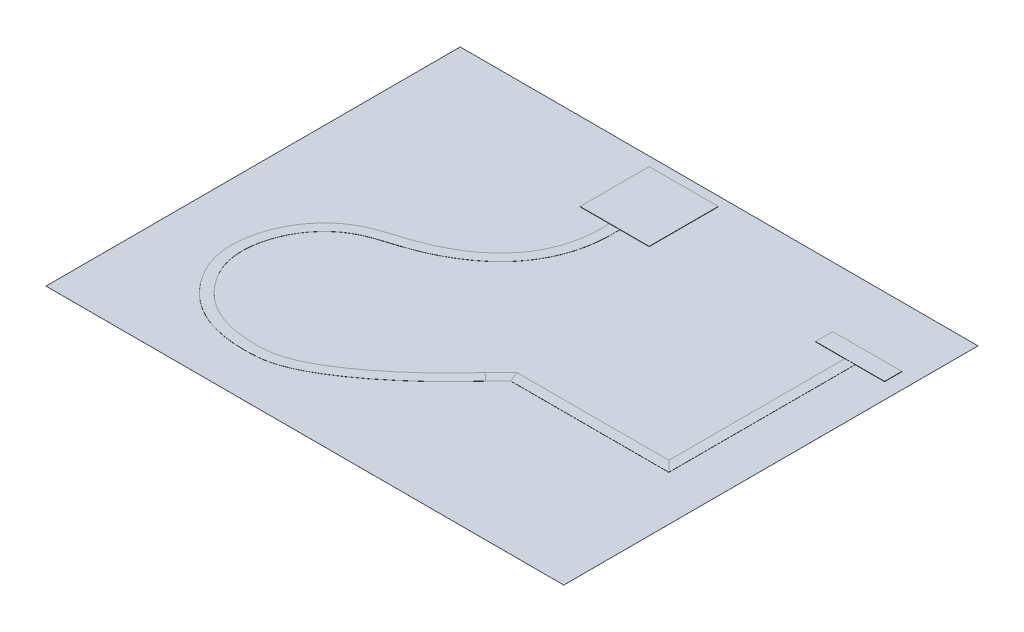
from build123d import *

# Parameters (mm, degrees)
SWEEP4_START             = -0.5
SWEEP4_DEPTH             = 1
BOSS_EXTRUDE3_DEPTH      = 1
BOSS_EXTRUDE3_DEPTH_BACK = 1
SKETCH13_W               = 200
SKETCH13_H               = 50
BOSS_EXTRUDE4_DEPTH      = 1
BOSS_EXTRUDE4_DEPTH_BACK = 1
SKETCH16_W               = 200
SKETCH16_H               = 200
SKETCH1_W                = 1500
SKETCH1_H                = 1200
BOSS_EXTRUDE6_DEPTH      = 0.05


# Read off the part's stored shape, not the designer's step: Sweep4
with BuildPart() as part:
    # Sweep4 outline → Sweep4 (new body)
    with BuildSketch(Plane(origin=(0, 0, 0), x_dir=(1, 0, 0), z_dir=(0, 1, 0)).offset(SWEEP4_START)):
        with BuildLine():
            add(Edge.make_bspline(
                [(103.505719826, -181.364046094), (103.414207185, -181.466182097), (103.322204924, -181.568864565), (101.691118748, -183.389296481), (100.158411854, -185.090003528), (97.050983778, -188.518394912), (95.485899265, -190.235324614), (90.757620947, -195.393015991), (87.561402627, -198.840678935), (77.849331178, -209.200915736), (71.210063445, -216.130726327), (50.86793851, -236.9067526), (36.740719705, -250.73948142), (-6.783621906, -291.529807765), (-37.326878896, -317.779689886), (-98.465326769, -364.920374117), (-129.070949841, -385.809866865), (-172.609372808, -410.526244062), (-186.724869551, -417.661513541), (-213.690796644, -429.313124446), (-226.542146561, -433.825702637), (-247.545765202, -439.164920147), (-256.185663263, -440.655396551), (-274.017116901, -442.591507677), (-283.217372406, -443.030595236), (-309.993475221, -443.44486218), (-328.36780961, -442.914218831), (-366.622997668, -438.136318085), (-386.492449198, -433.891740554), (-425.965147585, -419.62467904), (-445.568964912, -409.617407297), (-483.062343379, -381.585284748), (-500.975442865, -363.55489786), (-524.469479441, -329.8168627), (-531.234671318, -318.590235131), (-539.73656659, -300.420757864), (-542.297071011, -294.142513988), (-546.714261172, -281.132679535), (-548.56477247, -274.416950719), (-552.874769461, -253.433753177), (-554.135250856, -238.294079995), (-553.22480771, -206.868917306), (-551.056003291, -190.585562173), (-539.266410305, -141.746136524), (-524.359412718, -109.238143899), (-491.269439791, -66.966315646), (-478.455270713, -53.947722922), (-449.179171373, -31.013479434), (-432.71813341, -21.093925215), (-399.019942157, -6.624636989), (-381.799364398, -1.25136522), (-354.009683511, 7.304719653), (-344.423223242, 10.245336108), (-324.77160927, 16.742204503), (-314.722409469, 20.321758125), (-264.229433387, 40.021435969), (-222.612320366, 61.524314733), (-166.551476335, 105.442366663), (-148.930888002, 122.031207585), (-117.308840032, 159.590300645), (-103.311088676, 180.564246243), (-80.489992118, 227.233738595), (-71.673011905, 252.925040407), (-60.664159611, 309.198751903), (-58.470178144, 339.775960502), (-60.2136918, 372.901094516)],
                knots=[-0.000324793, -0.000324793, -0.000324793, -0.000324793, 0, 0, 0.005507124, 0.005507124, 0.011014249, 0.011014249, 0.022028497, 0.022028497, 0.044056995, 0.044056995, 0.088113989, 0.088113989, 0.176227978, 0.176227978, 0.264341967, 0.264341967, 0.308398962, 0.308398962, 0.352455956, 0.352455956, 0.385895355, 0.385895355, 0.419334753, 0.419334753, 0.4747688, 0.4747688, 0.530202848, 0.530202848, 0.585636895, 0.585636895, 0.641070943, 0.641070943, 0.665548814, 0.665548814, 0.67778775, 0.67778775, 0.690026686, 0.690026686, 0.714504557, 0.714504557, 0.738982428, 0.738982428, 0.787938171, 0.787938171, 0.812416042, 0.812416042, 0.836893913, 0.836893913, 0.857282174, 0.857282174, 0.867476305, 0.867476305, 0.877670435, 0.877670435, 0.918446957, 0.918446957, 0.938835218, 0.938835218, 0.959223478, 0.959223478, 0.979611739, 0.979611739, 1, 1, 1, 1], degree=3))
            Line((-60.2136918, 372.901094516), (-90.172222619, 371.324252371))
            add(Edge.make_bspline(
                [(125.299458682, -201.99671411), (75.135167192, -257.946580214), (13.197786751, -316.70497639), (-81.022825184, -389.353600442), (-112.674121575, -410.998574736), (-158.591880887, -437.065680106), (-173.640245418, -444.688535154), (-202.976808198, -457.364465548), (-217.264086882, -462.421304134), (-241.586922822, -468.604282114), (-251.715768553, -470.34638339), (-272.010371777, -472.549939414), (-282.167429329, -473.017941326), (-310.500581173, -473.456298182), (-330.287134169, -472.907581694), (-372.139631055, -467.680393272), (-394.216977075, -462.999241483), (-438.635766597, -446.944458599), (-460.976639623, -435.555615269), (-503.582517312, -403.701105659), (-523.823983632, -383.240975455), (-549.870126014, -345.838051329), (-557.540818323, -333.156097497), (-567.34210794, -312.209672823), (-570.324224919, -304.907111077), (-575.501656851, -289.658156454), (-577.696977464, -281.691011266), (-582.769842936, -256.993792555), (-584.185038469, -239.578080376), (-583.149855003, -203.847338729), (-580.697355874, -185.530174886), (-567.470790886, -130.737966348), (-550.830686746, -94.384766494), (-513.468406064, -46.655144122), (-498.943223768, -31.888309657), (-465.692235619, -5.840226898), (-446.965537475, 5.437117937), (-408.848114076, 21.803930668), (-390.663641408, 27.40916617), (-362.819061884, 35.982153626), (-353.439654553, 38.861446516), (-334.588763387, 45.093594127), (-325.096646737, 48.476659525), (-277.252092639, 67.143063754), (-238.204975665, 87.418659261), (-186.506395901, 127.919314401), (-170.413329834, 143.095208447), (-141.725081062, 177.169680995), (-129.12619008, 196.064566041), (-108.575719019, 238.090594444), (-100.617773947, 261.225982745), (-90.603197739, 312.417274722), (-88.548675966, 340.478379495), (-90.172222619, 371.324252371)],
                knots=[0.000321866, 0.000321866, 0.000321866, 0.000321866, 0.176227978, 0.176227978, 0.264341967, 0.264341967, 0.308398962, 0.308398962, 0.352455956, 0.352455956, 0.385895355, 0.385895355, 0.419334753, 0.419334753, 0.4747688, 0.4747688, 0.530202848, 0.530202848, 0.585636895, 0.585636895, 0.641070943, 0.641070943, 0.665548814, 0.665548814, 0.67778775, 0.67778775, 0.690026686, 0.690026686, 0.714504557, 0.714504557, 0.738982428, 0.738982428, 0.787938171, 0.787938171, 0.812416042, 0.812416042, 0.836893913, 0.836893913, 0.857282174, 0.857282174, 0.867476305, 0.867476305, 0.877670435, 0.877670435, 0.918446957, 0.918446957, 0.938835218, 0.938835218, 0.959223478, 0.959223478, 0.979611739, 0.979611739, 1, 1, 1, 1], degree=3))
            Line((125.299458682, -201.99671411), (162.020873286, -165.275299505))
            Line((162.020873286, -165.275299505), (619.599203169, -165.275299505))
            Line((619.599203169, -165.275299505), (619.599203169, 399.724700495))
            Line((619.599203169, 399.724700495), (589.599203169, 399.724700495))
            Line((589.599203169, 399.724700495), (589.599203169, -135.275299505))
            Line((589.599203169, -135.275299505), (149.594466415, -135.275299505))
            Line((149.594466415, -135.275299505), (103.505719826, -181.364046094))
        make_face()
    extrude(amount=SWEEP4_DEPTH)

    # Sketch13 → Boss-Extrude3 (add, two sides: drawn at the far end of the back side and taken through both)
    with BuildSketch(Plane(origin=(0, 0, 0), x_dir=(1, 0, 0), z_dir=(0, 1, 0)).offset(-BOSS_EXTRUDE3_DEPTH_BACK)):
        with Locations((604.599203169, 399.724700495)):
            Rectangle(SKETCH13_W, SKETCH13_H)
    extrude(amount=BOSS_EXTRUDE3_DEPTH + BOSS_EXTRUDE3_DEPTH_BACK)



with BuildPart() as body_2:
    # Sketch16 → Boss-Extrude4 (new, two sides: drawn at the far end of the back side and taken through both)
    with BuildSketch(Plane(origin=(0, 0, 0), x_dir=(1, 0, 0), z_dir=(0, 1, 0)).offset(-BOSS_EXTRUDE4_DEPTH_BACK)):
        with Locations((-75.19295721, 472.520538185)):
            Rectangle(SKETCH16_W, SKETCH16_H)
    extrude(amount=BOSS_EXTRUDE4_DEPTH + BOSS_EXTRUDE4_DEPTH_BACK)


with BuildPart() as part_1:
    add(part.part)

    add(body_2.part)  # Boss-Extrude6 merges body 2
    # Sketch1 → Boss-Extrude6 (add)
    with BuildSketch(Plane(origin=(0, 0, 0), x_dir=(1, 0, 0), z_dir=(0, 1, 0))):
        Rectangle(SKETCH1_W, SKETCH1_H)
    extrude(amount=BOSS_EXTRUDE6_DEPTH)


solid = part_1.part
